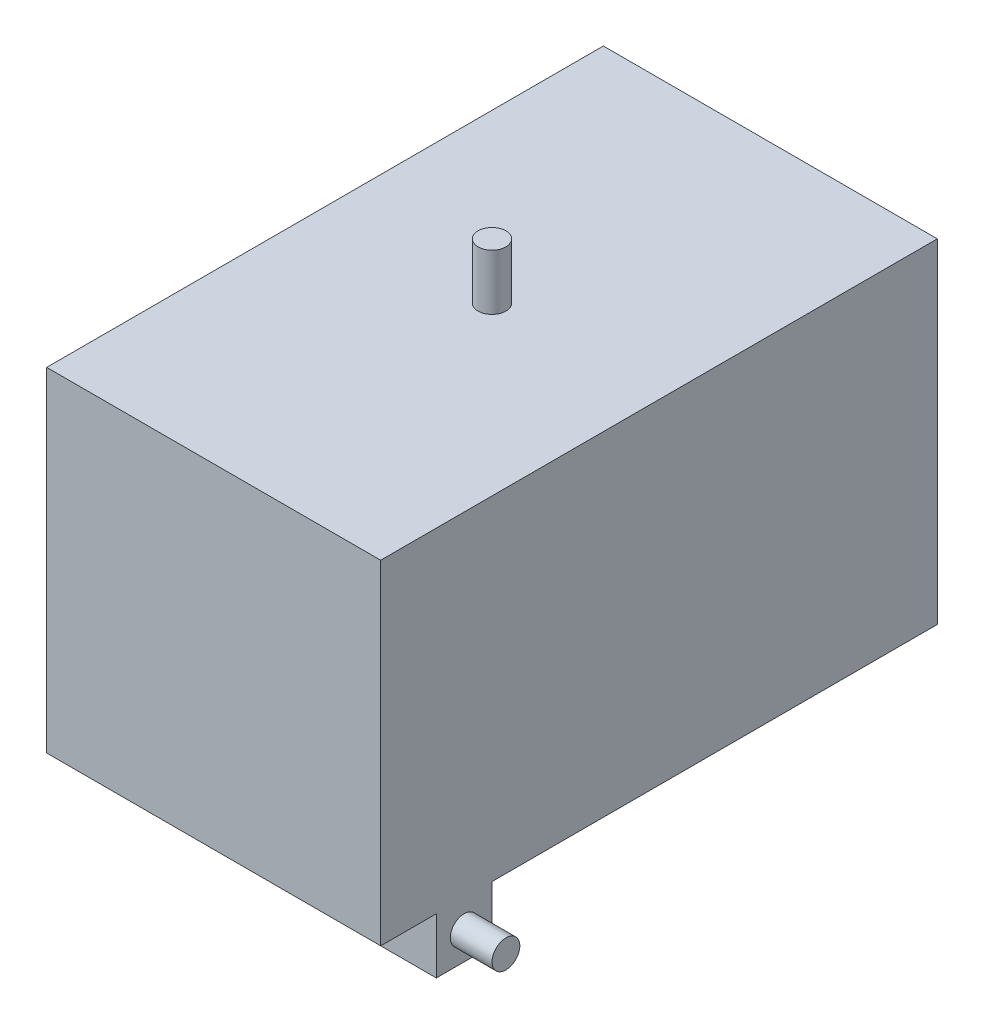
from build123d import *

# Parameters (mm, degrees)
SKETCH1_W             = 152.4
SKETCH1_H             = 152.4
SKETCH1_W_2           = 146.05
SKETCH1_H_2           = 146.05
BOSS_EXTRUDE1_DEPTH   = 127
SKETCH2_W             = 146.05
SKETCH2_H             = 146.05
BOSS_EXTRUDE2_DEPTH   = 3.175
SKETCH3_W             = 146.05
SKETCH3_H             = 146.05
BOSS_EXTRUDE3_DEPTH   = 3.175
SKETCH4_W             = 50.8
SKETCH4_H             = 25.4
BOSS_EXTRUDE4_DEPTH   = 25.4
BOSS_EXTRUDE4_2_DEPTH = 25.4
SKETCH7_R             = 6.35
BOSS_EXTRUDE5_DEPTH   = 25.4
SKETCH8_R             = 6.35
BOSS_EXTRUDE6_DEPTH   = 19.05
SKETCH9_R             = 6.35
BOSS_EXTRUDE7_DEPTH   = 19.05


with BuildPart() as part:
    # Sketch1 → Boss-Extrude1 (new, symmetric)
    with BuildSketch(Plane.XY):
        Rectangle(SKETCH1_W, SKETCH1_H)
        Rectangle(SKETCH1_W_2, SKETCH1_H_2, mode=Mode.SUBTRACT)
    extrude(amount=BOSS_EXTRUDE1_DEPTH, both=True)

    # Sketch2 → Boss-Extrude2 (add)
    with BuildSketch(Plane.XY.offset(127)):
        Rectangle(SKETCH2_W, SKETCH2_H)
    extrude(amount=-BOSS_EXTRUDE2_DEPTH)

    # Sketch3 → Boss-Extrude3 (add)
    with BuildSketch(Plane(origin=(0, 0, -127), x_dir=(-1, 0, 0), z_dir=(0, 0, -1))):
        Rectangle(SKETCH3_W, SKETCH3_H)
    extrude(amount=-BOSS_EXTRUDE3_DEPTH)

    # Sketch6 → Revolve2 (revolve)
    with BuildSketch(Plane(origin=(0, 0, -101.6), x_dir=(-1, 0, 0), z_dir=(0, 0, -1))):
        with BuildLine():
            Line((0, -76.2), (0, -127))
            ThreePointArc((0, -127), (17.960512242, -119.560512242), (25.4, -101.6))
            Line((25.4, -101.6), (9.525, -101.6))
            Line((9.525, -101.6), (9.525, -76.2))
            Line((9.525, -76.2), (0, -76.2))
        make_face()
    revolve(axis=Axis((0, -76.2, -101.6), (0, -1, 0)))

    # Sketch7 → Boss-Extrude5 (add)
    with BuildSketch(Plane(origin=(0, 76.2, 0), x_dir=(1, 0, 0), z_dir=(0, 1, 0))):
        Circle(SKETCH7_R)
    extrude(amount=BOSS_EXTRUDE5_DEPTH)


with BuildPart() as body_2:
    # Sketch4 → Boss-Extrude4 (new body)
    with BuildSketch(Plane.XZ.offset(76.2)):
        with Locations((50.8, 88.9)):
            Rectangle(SKETCH4_W, SKETCH4_H)
    extrude(amount=BOSS_EXTRUDE4_DEPTH)


    add(part.part)  # Boss-Extrude6 merges part
    # Sketch8 → Boss-Extrude6 (add)
    with BuildSketch(Plane(origin=(76.2, 0, 0), x_dir=(0, 0, -1), z_dir=(1, 0, 0))):
        with Locations((-88.9, -88.9)):
            Circle(SKETCH8_R)
    extrude(amount=BOSS_EXTRUDE6_DEPTH)


with BuildPart() as body_3:
    # Sketch4 → Boss-Extrude4 2 (new body)
    with BuildSketch(Plane.XZ.offset(76.2)):
        with Locations((-50.8, 88.9)):
            Rectangle(SKETCH4_W, SKETCH4_H)
    extrude(amount=BOSS_EXTRUDE4_2_DEPTH)


    add(body_2.part)  # Boss-Extrude7 merges body 2
    # Sketch9 → Boss-Extrude7 (add)
    with BuildSketch(Plane.ZY.offset(76.2)):
        with Locations((88.9, -88.9)):
            Circle(SKETCH9_R)
    extrude(amount=BOSS_EXTRUDE7_DEPTH)


solid = body_3.part
